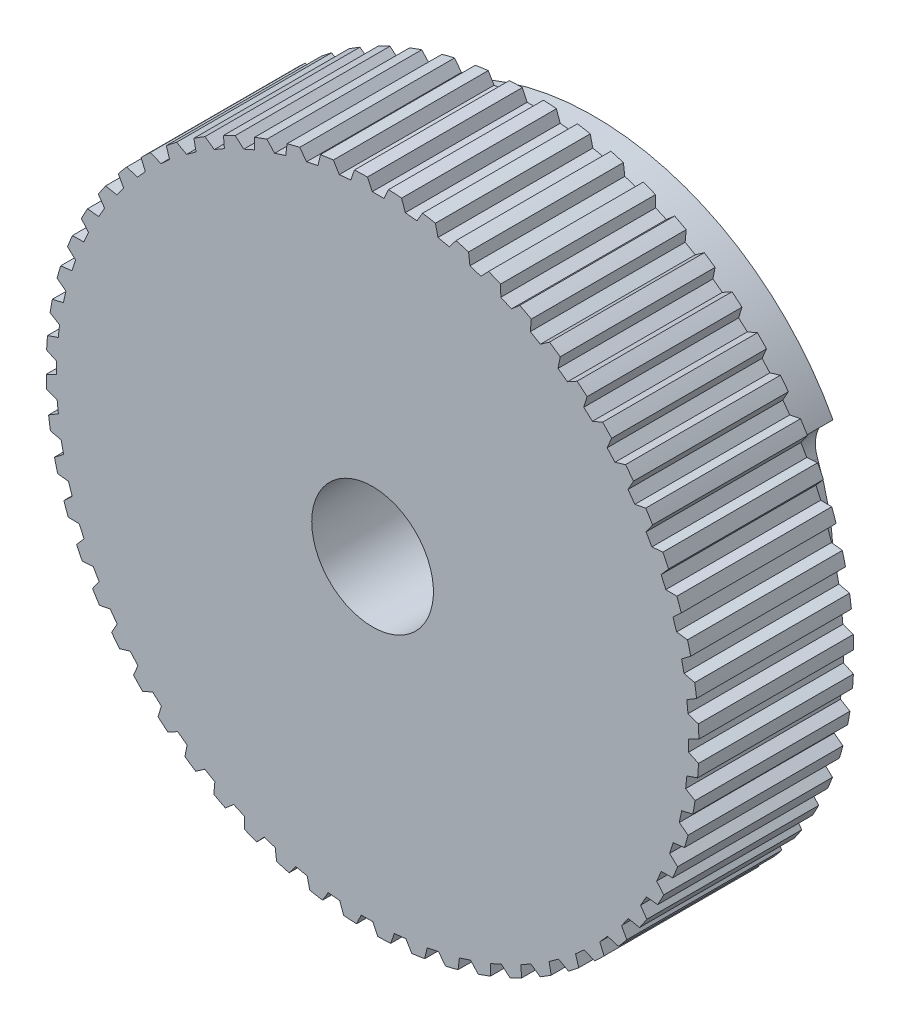
from build123d import *

# Parameters (mm, degrees)
ESQUISSE1_R                  = 29.5
EXTRUSION3_DEPTH             = 14
ESQUISSE7_R                  = 24.5
EXTRUSION4_DEPTH             = 6
EXTRUSION5_START             = -6
EXTRUSION5_DEPTH             = 6
CONG_1_R                     = 3
CONG_2_R                     = 3
ESQUISSE9_R                  = 5.5
EXTRUSION6_DEPTH             = 47.265537931
EXTRUSION7_DEPTH             = 45.005681451
R_P_TITION_CIRCULAIRE1_COUNT = 60


with BuildPart() as part:
    # Esquisse1 → Extrusion3 (new body)
    with BuildSketch(Plane.XY):
        Circle(ESQUISSE1_R)
    extrude(amount=EXTRUSION3_DEPTH)

    # Esquisse7 → Extrusion4 (add)
    with BuildSketch(Plane(origin=(0, 0, 0), x_dir=(-1, 0, 0), z_dir=(0, 0, -1))):
        with Locations(Location((0, 0, 0), (0, 0, 180))):
            Circle(ESQUISSE7_R)
    extrude(amount=EXTRUSION4_DEPTH)

    # Esquisse8 → Extrusion5 (cut)
    with BuildSketch(Plane(origin=(0, 0, -6), x_dir=(-1, 0, 0), z_dir=(0, 0, -1)).offset(EXTRUSION5_START)):
        with BuildLine():
            Line((-19.058091896, 10.334178475), (-21.620412287, 11.524225464))
            ThreePointArc((-21.620412287, 11.524225464), (-16.8993266, -17.738736157), (12.557969209, -21.036810817))
            Line((12.557969209, -21.036810817), (10.925988768, -18.72508694))
            ThreePointArc((10.925988768, -18.72508694), (-15.087842852, -15.568015594), (-19.058091896, 10.334178475))
        make_face()
    extrude(amount=EXTRUSION5_DEPTH, mode=Mode.SUBTRACT)

    # Congé1
    # the kernel refuses this fillet: 3 mm, written as the material it adds along each edge
    with BuildSketch(Plane(origin=(19.058091896, 10.334178475, 7.062974595), x_dir=(0.9069551207927639, 0.42122726510493486, 0), z_dir=(0, 0, -1))) as cong_1_piece_1:
        with BuildLine():
            CenterArc((2.986479467, 2.995661138), CONG_1_R, 183.83536191, 83.082747184)
            Line((-0.006801659, 2.794992001), (-0.066667282, 2.790978618))
            ThreePointArc((-0.066667282, 2.790978618), (-0.01831145, 1.397459715), (-0.059884447, 0.003721969))
            Line((-0.059884447, 0.003721969), (0, -0.06))
            ThreePointArc((0, -0.06), (1.412594919, -0.06), (2.821964046, -0.059913223))
            Line((2.821964046, -0.059913223), (2.825189838, 0))
        make_face()
    extrude(amount=13.062974595)

    # Congé2
    cong_2_edges = [part.edges().sort_by_distance(p)[0] for p in [
        (-10.925988768, -18.72508694, -3),
    ]]
    fillet(cong_2_edges, radius=CONG_2_R)

    # Esquisse9 → Extrusion6 (cut, through all)
    with BuildSketch(Plane(origin=(0, 0, -6), x_dir=(-1, 0, 0), z_dir=(0, 0, -1))):
        Circle(ESQUISSE9_R)
    extrude(amount=-EXTRUSION6_DEPTH, mode=Mode.SUBTRACT)

    # Esquisse10 → Extrusion7 (cut, through all)
    with BuildSketch(Plane(origin=(0, 0, 0), x_dir=(-1, 0, 0), z_dir=(0, 0, -1))):
        Polygon((1.5, -29.57709998), (-0.5, -29.57709998), (-0.027442915, -28.56369804), (1.027442915, -28.56369804), align=None)
    extrusion7 = extrude(amount=-EXTRUSION7_DEPTH, mode=Mode.SUBTRACT)

    # Répétition circulaire1: Extrusion7 ×60 about axis
    r_p_tition_circulaire1_axis = Axis((0, 0, 0), (0, 0, 1))
    for i in range(1, R_P_TITION_CIRCULAIRE1_COUNT):
        add(extrusion7.rotate(r_p_tition_circulaire1_axis, i * 360 / R_P_TITION_CIRCULAIRE1_COUNT), mode=Mode.SUBTRACT)


solid = part.part
